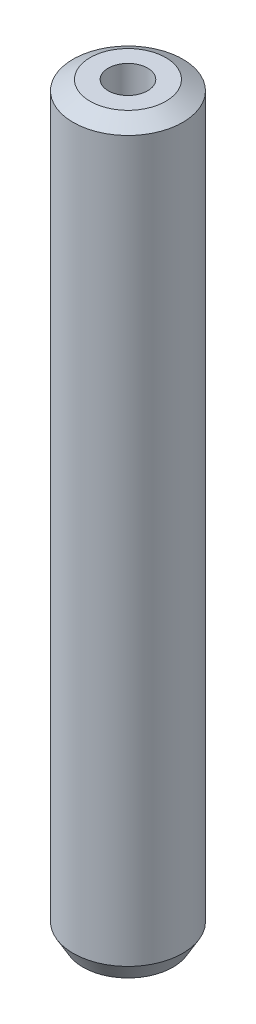
from build123d import *
from OCP.BRepFilletAPI import BRepFilletAPI_MakeChamfer

# Parameters (mm, degrees)
SKETCH1_R           = 10
BOSS_EXTRUDE1_DEPTH = 136.159849882
SKETCH2_R           = 3.59120173
CUT_EXTRUDE1_DEPTH  = 137.892310668
CHAMFER1_SIZE       = 1.786595205
CHAMFER1_SIZE2      = 3.094473668


with BuildPart() as part:
    # Sketch1 → Boss-Extrude1 (new body)
    with BuildSketch(Plane(origin=(0, 0, 0), x_dir=(1, 0, 0), z_dir=(0, 1, 0))):
        Circle(SKETCH1_R)
    extrude(amount=BOSS_EXTRUDE1_DEPTH)

    # Sketch2 → Cut-Extrude1 (cut, through all)
    with BuildSketch(Plane(origin=(0, 0, 0), x_dir=(1, 0, 0), z_dir=(0, 1, 0))):
        Circle(SKETCH2_R)
    extrude(amount=CUT_EXTRUDE1_DEPTH, mode=Mode.SUBTRACT)

    # Chamfer1: one chamfer whose edges measure the first distance from different faces: ONE call of the kernel's chamfer builder (chamfer() names one face for all edges)
    chamfer1_edges_1 = [part.edges().sort_by_distance(p)[0] for p in [
        (-10, 136.159849882, 0),
    ]]
    chamfer1_side_1 = [part.faces().sort_by_distance(p)[0] for p in [
        (-10, 68.079924941, 0),
    ]]
    chamfer1_edges_2 = [part.edges().sort_by_distance(p)[0] for p in [
        (-10, 0, 0),
    ]]
    chamfer1_side_2 = [part.faces().sort_by_distance(p)[0] for p in [
        (-9.717157288, 0, 0),
    ]]
    chamfer1 = BRepFilletAPI_MakeChamfer(part.part.solid().wrapped)
    for e in chamfer1_edges_1:
        chamfer1.Add(CHAMFER1_SIZE, CHAMFER1_SIZE2, e.wrapped, chamfer1_side_1[0].wrapped)  # the first distance lies on this face
    for e in chamfer1_edges_2:
        chamfer1.Add(CHAMFER1_SIZE, CHAMFER1_SIZE2, e.wrapped, chamfer1_side_2[0].wrapped)  # the first distance lies on this face
    add(Compound.cast(chamfer1.Shape()), mode=Mode.REPLACE)


solid = part.part
